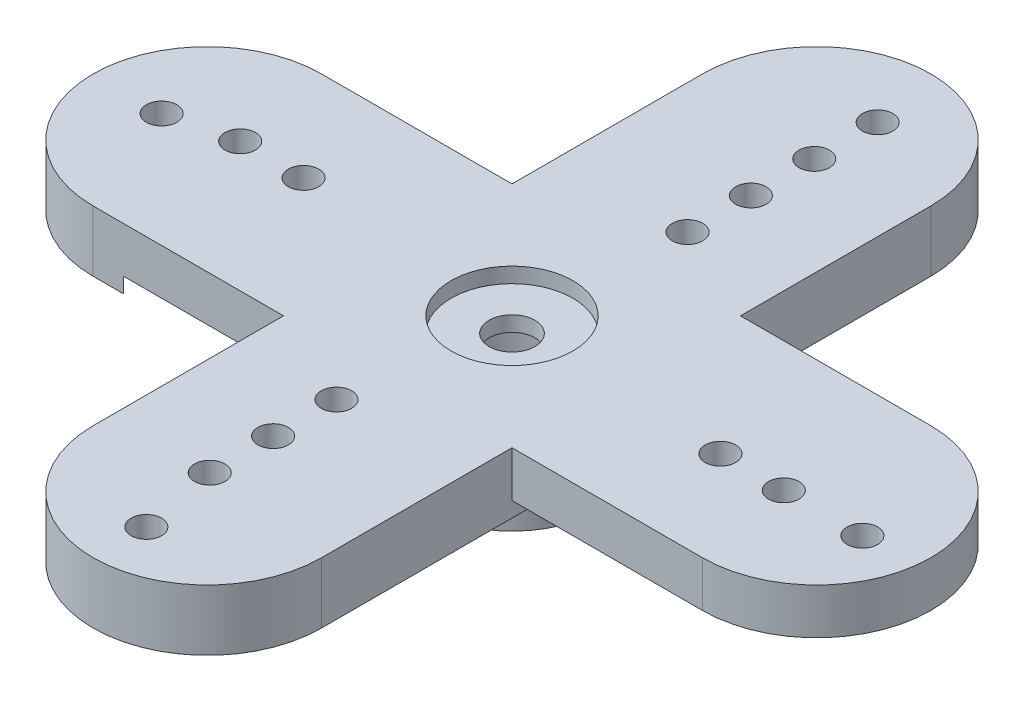
from build123d import *
from OCP.BRepAlgoAPI import BRepAlgoAPI_Cut
from OCP.TopTools import TopTools_ListOfShape

# Parameters (mm, degrees)
SKETCH1_R           = 0.79375
SKETCH1_R_2         = 1.190625
BOSS_EXTRUDE1_DEPTH = 3.175
CUT_EXTRUDE1_DEPTH  = 0.79375
SKETCH4_R           = 3.175
CUT_EXTRUDE2_DEPTH  = 0.79375
SKETCH5_R           = 4.7625
SKETCH5_R_2         = 3.048
BOSS_EXTRUDE2_DEPTH = 3.175
CUT_EXTRUDE3_START  = -1.5875
SKETCH6_R           = 3.048
CUT_EXTRUDE3_DEPTH  = 1.5875


with BuildPart() as part:
    # Sketch1 → Boss-Extrude1 (new body)
    with BuildSketch(Plane(origin=(0, 0, 0), x_dir=(1, 0, 0), z_dir=(0, 1, 0))):
        with BuildLine():
            Line((5.953125, 15.875), (5.953125, 5.952125))
            Line((5.953125, 5.952125), (15.876, 5.952125))
            ThreePointArc((15.876, 5.952125), (21.829125, -0.001), (15.876, -5.954125))
            Line((15.876, -5.954125), (5.953125, -5.954125))
            Line((5.953125, -5.954125), (5.953125, -15.875))
            ThreePointArc((5.953125, -15.875), (0, -21.828125), (-5.953125, -15.875))
            Line((-5.953125, -15.875), (-5.953125, -5.954125))
            Line((-5.953125, -5.954125), (-15.874, -5.954125))
            ThreePointArc((-15.874, -5.954125), (-21.827125, -0.001), (-15.874, 5.952125))
            Line((-15.874, 5.952125), (-5.953125, 5.952125))
            Line((-5.953125, 5.952125), (-5.953125, 15.875))
            ThreePointArc((-5.953125, 15.875), (0, 21.828125), (5.953125, 15.875))
        make_face()
        with Locations((-18.25625, 0)):
            Circle(SKETCH1_R, mode=Mode.SUBTRACT)
        with Locations((0.79375, 18.25625)):
            Circle(SKETCH1_R, mode=Mode.SUBTRACT)
        with Locations((19.05, -0.79375)):
            Circle(SKETCH1_R, mode=Mode.SUBTRACT)
        with Locations((0, -19.05)):
            Circle(SKETCH1_R, mode=Mode.SUBTRACT)
        Circle(SKETCH1_R_2, mode=Mode.SUBTRACT)
        with Locations((0.79375, 14.95425)):
            Circle(SKETCH1_R, mode=Mode.SUBTRACT)
        with Locations((0.79375, 11.65225)):
            Circle(SKETCH1_R, mode=Mode.SUBTRACT)
        with Locations((14.95425, -0.79375)):
            Circle(SKETCH1_R, mode=Mode.SUBTRACT)
        with Locations((11.65225, -0.79375)):
            Circle(SKETCH1_R, mode=Mode.SUBTRACT)
        with Locations((-0.79375, -14.95425)):
            Circle(SKETCH1_R, mode=Mode.SUBTRACT)
        with Locations((-0.79375, -11.65225)):
            Circle(SKETCH1_R, mode=Mode.SUBTRACT)
        with Locations((-14.95425, 0.79375)):
            Circle(SKETCH1_R, mode=Mode.SUBTRACT)
        with Locations((-11.65225, 0.79375)):
            Circle(SKETCH1_R, mode=Mode.SUBTRACT)
        with Locations((0.79375, 8.35025)):
            Circle(SKETCH1_R, mode=Mode.SUBTRACT)
        with Locations((-0.79375, -8.35025)):
            Circle(SKETCH1_R, mode=Mode.SUBTRACT)
    extrude(amount=BOSS_EXTRUDE1_DEPTH)


with BuildPart() as cut_extrude1_tool:
    # Sketch3 → Cut-Extrude1 (new body)
    with BuildSketch(Plane.XZ):
        with BuildLine():
            Line((5.953125, -5.952125), (5.953125, 5.954125))
            Line((5.953125, 5.954125), (15.875998939, 5.954125))
            ThreePointArc((15.875998939, 5.954125), (21.829123939, 0.00100053), (15.876, -5.952125))
            Line((15.876, -5.952125), (5.953125, -5.952125))
        make_face()
        with BuildLine():
            Line((-14.288498939, 5.954125), (-4.365625, 5.954125))
            Line((-4.365625, 5.954125), (-4.365625, -5.952125))
            Line((-4.365625, -5.952125), (-14.2885, -5.952125))
            ThreePointArc((-14.2885, -5.952125), (-20.241623939, 0.00100053), (-14.288498939, 5.954125))
        make_face()
    extrude(amount=-CUT_EXTRUDE1_DEPTH)


with BuildPart() as part_1:
    add(part.part)

    # Cut-Extrude1: cut by cut_extrude1_tool, with a tolerance
    cut_extrude1_stock = TopTools_ListOfShape()
    cut_extrude1_stock.Append(part_1.part.wrapped)
    cut_extrude1_tools = TopTools_ListOfShape()
    cut_extrude1_tools.Append(cut_extrude1_tool.part.wrapped)
    cut_extrude1_cut = BRepAlgoAPI_Cut()
    cut_extrude1_cut.SetArguments(cut_extrude1_stock)
    cut_extrude1_cut.SetTools(cut_extrude1_tools)
    cut_extrude1_cut.SetFuzzyValue(0.00001)
    cut_extrude1_cut.Build()
    add(Compound.cast(cut_extrude1_cut.Shape()).solids(), mode=Mode.REPLACE)

    # Sketch4 → Cut-Extrude2 (cut)
    with BuildSketch(Plane(origin=(0, 3.175, 0), x_dir=(1, 0, 0), z_dir=(0, 1, 0))):
        Circle(SKETCH4_R)
    extrude(amount=-CUT_EXTRUDE2_DEPTH, mode=Mode.SUBTRACT)

    # Sketch5 → Boss-Extrude2 (add)
    with BuildSketch(Plane.XZ):
        Circle(SKETCH5_R)
        Circle(SKETCH5_R_2, mode=Mode.SUBTRACT)
    extrude(amount=BOSS_EXTRUDE2_DEPTH)

    # Sketch6 → Cut-Extrude3 (cut)
    with BuildSketch(Plane.XZ.offset(CUT_EXTRUDE3_START)):
        Circle(SKETCH6_R)
    extrude(amount=CUT_EXTRUDE3_DEPTH, mode=Mode.SUBTRACT)


solid = part_1.part
